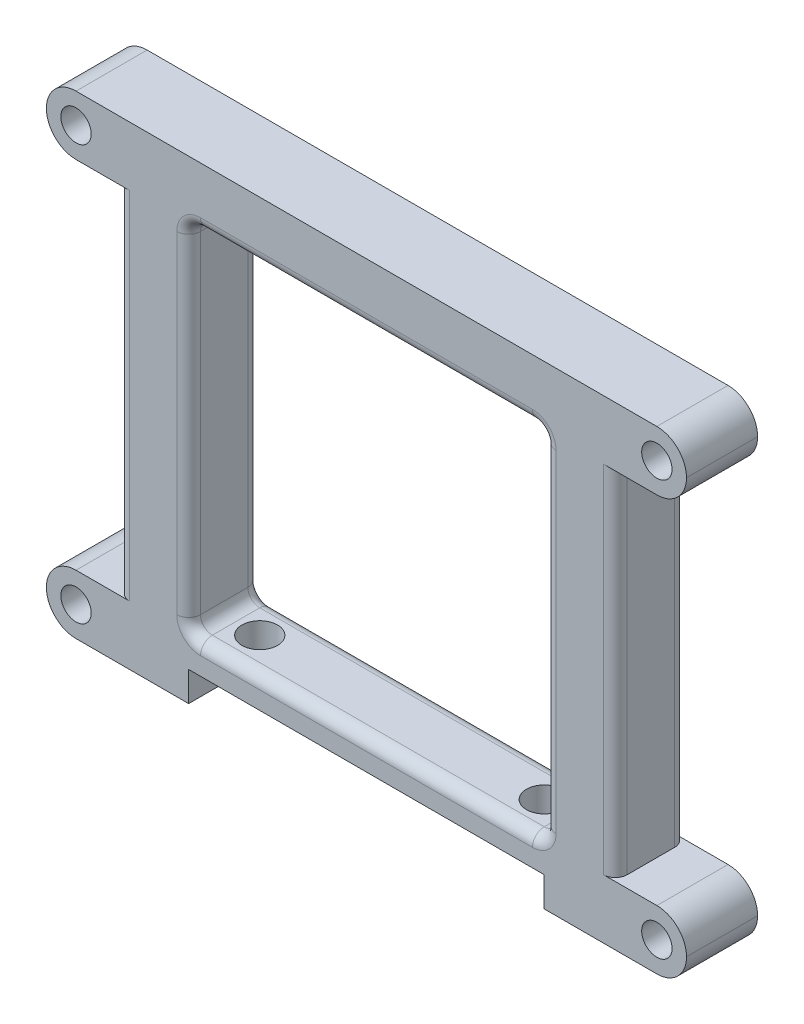
from build123d import *

# Parameters (mm, degrees)
SKETCH3_W           = 38.1
SKETCH3_H           = 38.1
BOSS_EXTRUDE2_DEPTH = 3.81
FILLET1_R           = 3.175
CUT_EXTRUDE1_REACH  = 61.178
SKETCH4_R           = 1.627
FILLET2_R           = 1.27
CUT_EXTRUDE2_REACH  = 60.809
SKETCH5_R           = 1.905


with BuildPart() as part:
    # Sketch3 → Boss-Extrude2 (new, symmetric)
    with BuildSketch(Plane.XY):
        Polygon((34.29, -3.175), (34.29, 3.175), (26.67, 3.175), (26.67, 41.275), (34.29, 41.275), (34.29, 47.625), (-34.29, 47.625), (-34.29, 41.275), (-26.67, 41.275), (-26.67, 3.175), (-34.29, 3.175), (-34.29, -3.175), (-19.05, -3.175), (-19.05, 0), (19.05, 0), (19.05, -3.175), align=None)
        with Locations((0, 22.225)):
            Rectangle(SKETCH3_W, SKETCH3_H, mode=Mode.SUBTRACT)
    extrude(amount=BOSS_EXTRUDE2_DEPTH, both=True)

    # Fillet1
    fillet1_edges = [part.edges().sort_by_distance(p)[0] for p in [
        (34.29, 3.175, 0),
        (34.29, 41.275, 0),
        (34.29, 47.625, 0),
        (-34.29, 3.175, 0),
        (-34.29, 41.275, 0),
        (-34.29, 47.625, 0),
        (34.29, -3.175, 0),
        (-34.29, -3.175, 0),
    ]]
    fillet(fillet1_edges, radius=FILLET1_R - 0.0001)  # a hair under: the kernel refuses the full size

    # Sketch4 → Cut-Extrude1 (cut, up to next)
    with BuildSketch(Plane.XY.offset(3.81), mode=Mode.PRIVATE) as cut_extrude1_sk1:
        with Locations((-31.115, 44.45)):
            Circle(SKETCH4_R)
    cut_extrude1_tool1 = extrude(cut_extrude1_sk1.sketch, amount=-CUT_EXTRUDE1_REACH, mode=Mode.PRIVATE) & part.part
    # Sketch4 → Cut-Extrude1 (cut, up to next)
    with BuildSketch(Plane.XY.offset(3.81), mode=Mode.PRIVATE) as cut_extrude1_sk2:
        with Locations((-31.115, 0)):
            Circle(SKETCH4_R)
    cut_extrude1_tool2 = extrude(cut_extrude1_sk2.sketch, amount=-CUT_EXTRUDE1_REACH, mode=Mode.PRIVATE) & part.part
    cut_extrude1_1 = cut_extrude1_tool1.solids().sort_by_distance((-31.115, 44.45, 3.81))[0]
    add(cut_extrude1_1, mode=Mode.SUBTRACT)
    cut_extrude1_2 = cut_extrude1_tool2.solids().sort_by_distance((-31.115, 0, 3.81))[0]
    add(cut_extrude1_2, mode=Mode.SUBTRACT)
    cut_extrude1 = cut_extrude1_1 + cut_extrude1_2  # Cut-Extrude1 as one shape, for the pattern or mirror that repeats it

    # Mirror1: Cut-Extrude1 across plane
    add(cut_extrude1.mirror(Plane(origin=(0, 0, 0), x_dir=(0, 0, 1), z_dir=(1, 0, 0))), mode=Mode.SUBTRACT)

    # Fillet2
    fillet2_edges = [part.edges().sort_by_distance(p)[0] for p in [
        (0, 3.175, 3.81),
        (0, 3.175, -3.81),
        (0, 41.275, 3.81),
        (0, 41.275, -3.81),
        (19.05, 41.275, 0),
        (19.05, 22.225, 3.81),
        (19.05, 3.175, 0),
        (19.05, 22.225, -3.81),
        (-19.05, 3.175, 0),
        (-19.05, 22.225, 3.81),
        (-19.05, 41.275, 0),
        (-19.05, 22.225, -3.81),
        (26.67, 22.225, 3.81),
        (26.67, 22.225, -3.81),
        (-26.67, 22.225, -3.81),
        (-26.67, 22.225, 3.81),
    ]]
    fillet(fillet2_edges, radius=FILLET2_R)

    # Sketch5 → Cut-Extrude2 (cut, up to next)
    with BuildSketch(Plane.XZ, mode=Mode.PRIVATE) as cut_extrude2_sk1:
        with Locations((-15.24, 0)):
            Circle(SKETCH5_R)
    cut_extrude2_tool1 = extrude(cut_extrude2_sk1.sketch, amount=-CUT_EXTRUDE2_REACH, mode=Mode.PRIVATE) & part.part
    # Sketch5 → Cut-Extrude2 (cut, up to next)
    with BuildSketch(Plane.XZ, mode=Mode.PRIVATE) as cut_extrude2_sk2:
        with Locations(Location((15.24, 0, 0), (0, 0, 180))):
            Circle(SKETCH5_R)
    cut_extrude2_tool2 = extrude(cut_extrude2_sk2.sketch, amount=-CUT_EXTRUDE2_REACH, mode=Mode.PRIVATE) & part.part
    add(cut_extrude2_tool1.solids().sort_by_distance((-15.24, 0, 0))[0], mode=Mode.SUBTRACT)
    add(cut_extrude2_tool2.solids().sort_by_distance((15.24, 0, 0))[0], mode=Mode.SUBTRACT)


solid = part.part
